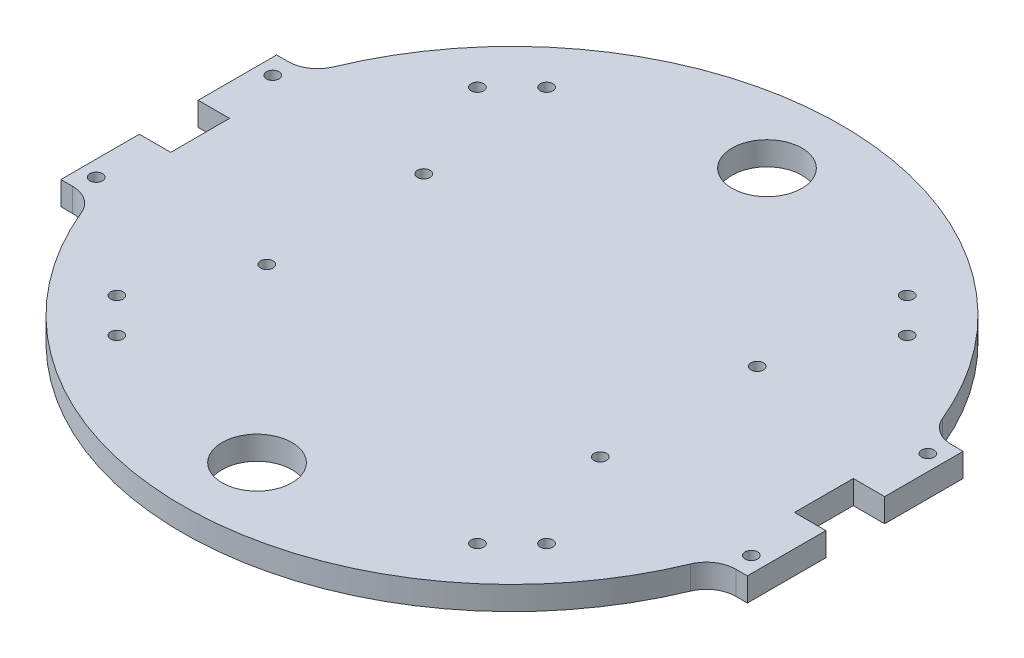
from build123d import *

# Parameters (mm, degrees)
ESQUISSE1_R        = 1.6
ESQUISSE1_R_2      = 8.9
BOSS_EXTRU_1_DEPTH = 6
CONG_1_R           = 7.5


with BuildPart() as part:
    # Esquisse1 → Boss.-Extru.1 (new body)
    with BuildSketch(Plane(origin=(0, 0, 0), x_dir=(1, 0, 0), z_dir=(0, 1, 0))):
        with BuildLine():
            Line((-87.5, 27.5), (-79.370964464, 27.5))
            ThreePointArc((-79.370964464, 27.5), (0, 84), (79.370964464, 27.5))
            Line((79.370964464, 27.5), (87.5, 27.5))
            Line((87.5, 27.5), (87.5, 7.5))
            Line((87.5, 7.5), (79.5, 7.5))
            Line((79.5, 7.5), (79.5, -7.5))
            Line((79.5, -7.5), (87.5, -7.5))
            Line((87.5, -7.5), (87.5, -27.5))
            Line((87.5, -27.5), (79.370964464, -27.5))
            ThreePointArc((79.370964464, -27.5), (0, -84), (-79.370964464, -27.5))
            Line((-79.370964464, -27.5), (-87.5, -27.5))
            Line((-87.5, -27.5), (-87.5, -7.5))
            Line((-87.5, -7.5), (-79.5, -7.5))
            Line((-79.5, -7.5), (-79.5, 7.5))
            Line((-79.5, 7.5), (-87.5, 7.5))
            Line((-87.5, 7.5), (-87.5, 27.5))
        make_face()
        with Locations((-54.772177683, 45.959314093)):
            Circle(ESQUISSE1_R, mode=Mode.SUBTRACT)
        with Locations((-45.959314093, 54.772177683)):
            Circle(ESQUISSE1_R, mode=Mode.SUBTRACT)
        with Locations((54.772177683, 45.959314093)):
            Circle(ESQUISSE1_R, mode=Mode.SUBTRACT)
        with Locations((45.959314093, 54.772177683)):
            Circle(ESQUISSE1_R, mode=Mode.SUBTRACT)
        with Locations((45.959314093, -54.772177683)):
            Circle(ESQUISSE1_R, mode=Mode.SUBTRACT)
        with Locations((54.772177683, -45.959314093)):
            Circle(ESQUISSE1_R, mode=Mode.SUBTRACT)
        with Locations((-54.772177683, -45.959314093)):
            Circle(ESQUISSE1_R, mode=Mode.SUBTRACT)
        with Locations((-45.959314093, -54.772177683)):
            Circle(ESQUISSE1_R, mode=Mode.SUBTRACT)
        with Locations((0, 65)):
            Circle(ESQUISSE1_R_2, mode=Mode.SUBTRACT)
        with Locations((0, -65)):
            Circle(ESQUISSE1_R_2, mode=Mode.SUBTRACT)
        with Locations((-83.5, 22.5)):
            Circle(ESQUISSE1_R, mode=Mode.SUBTRACT)
        with Locations((-83.5, -22.5)):
            Circle(ESQUISSE1_R, mode=Mode.SUBTRACT)
        with Locations((-42.5, 20)):
            Circle(ESQUISSE1_R, mode=Mode.SUBTRACT)
        with Locations((-42.5, -20)):
            Circle(ESQUISSE1_R, mode=Mode.SUBTRACT)
        with Locations((42.5, -20)):
            Circle(ESQUISSE1_R, mode=Mode.SUBTRACT)
        with Locations((42.5, 20)):
            Circle(ESQUISSE1_R, mode=Mode.SUBTRACT)
        with Locations((83.5, -22.5)):
            Circle(ESQUISSE1_R, mode=Mode.SUBTRACT)
        with Locations((83.5, 22.5)):
            Circle(ESQUISSE1_R, mode=Mode.SUBTRACT)
    extrude(amount=BOSS_EXTRU_1_DEPTH)

    # Congé1
    cong_1_edges = [part.edges().sort_by_distance(p)[0] for p in [
        (-79.370964464, 3, 27.5),
        (-79.370964464, 3, -27.5),
        (79.370964464, 3, -27.5),
        (79.370964464, 3, 27.5),
    ]]
    fillet(cong_1_edges, radius=CONG_1_R)


solid = part.part
